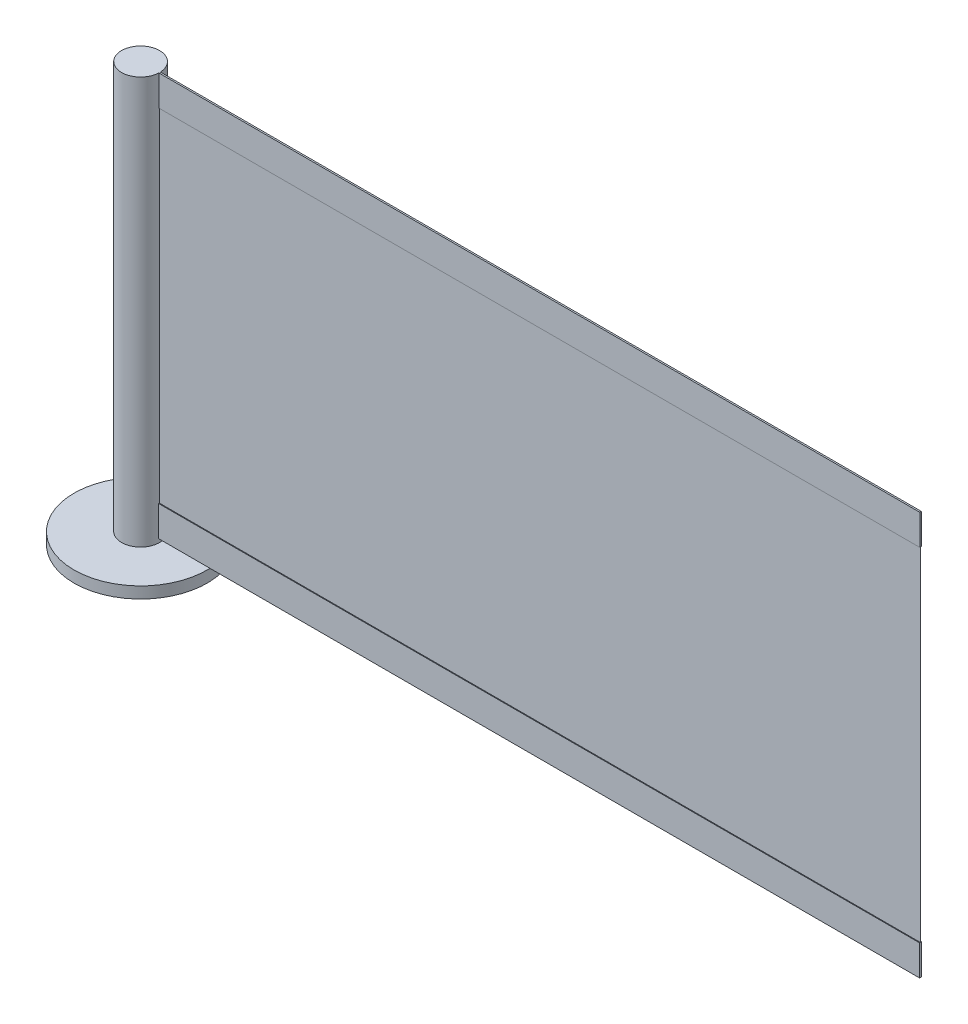
from build123d import *

# Parameters (mm, degrees)
SKETCH2_R           = 175
BOSS_EXTRUDE1_DEPTH = 30
SKETCH3_R           = 50
BOSS_EXTRUDE2_DEPTH = 1070
SKETCH7_W           = 2050
SKETCH7_H           = 1
BOSS_EXTRUDE3_DEPTH = 1060
SKETCH8_W           = 2050
SKETCH8_H           = 4
BOSS_EXTRUDE4_DEPTH = 80
SKETCH11_W          = 2050
SKETCH11_H          = 4.938385514
BOSS_EXTRUDE5_DEPTH = 80


with BuildPart() as part:
    # Sketch2 → Boss-Extrude1 (new body)
    with BuildSketch(Plane(origin=(0, 0, 0), x_dir=(1, 0, 0), z_dir=(0, 1, 0))):
        Circle(SKETCH2_R)
    extrude(amount=BOSS_EXTRUDE1_DEPTH)

    # Sketch3 → Boss-Extrude2 (add)
    with BuildSketch(Plane(origin=(0, 30, 0), x_dir=(1, 0, 0), z_dir=(0, 1, 0))):
        Circle(SKETCH3_R)
    extrude(amount=BOSS_EXTRUDE2_DEPTH)

    # Sketch7 → Boss-Extrude3 (add)
    with BuildSketch(Plane(origin=(0, 1100, 0), x_dir=(1, 0, 0), z_dir=(0, 1, 0))):
        with Locations((1025, 0)):
            Rectangle(SKETCH7_W, SKETCH7_H)
    extrude(amount=-BOSS_EXTRUDE3_DEPTH)

    # Sketch8 → Boss-Extrude4 (add)
    with BuildSketch(Plane(origin=(0, 1100, 0), x_dir=(1, 0, 0), z_dir=(0, 1, 0))):
        with Locations((1025, 0)):
            Rectangle(SKETCH8_W, SKETCH8_H)
    extrude(amount=-BOSS_EXTRUDE4_DEPTH)

    # Sketch11 → Boss-Extrude5 (add)
    with BuildSketch(Plane(origin=(0, 40, 0), x_dir=(-1, 0, 0), z_dir=(0, -1, 0))):
        with Locations((-1025, 0)):
            Rectangle(SKETCH11_W, SKETCH11_H)
    extrude(amount=-BOSS_EXTRUDE5_DEPTH)


solid = part.part
